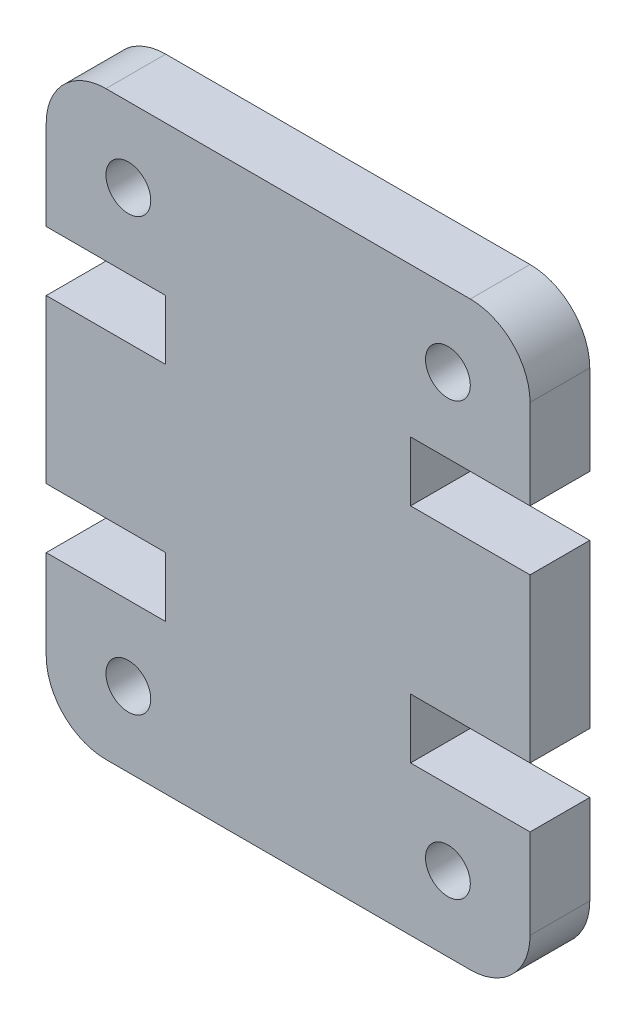
from build123d import *

# Parameters (mm, degrees)
SKETCH2_R           = 0.75
BOSS_EXTRUDE1_DEPTH = 4
SKETCH3_W           = 16.2
SKETCH3_H           = 19.455
CUT_EXTRUDE1_DEPTH  = 2


with BuildPart() as part:
    # Sketch2 → Boss-Extrude1 (new body)
    with BuildSketch(Plane.XY):
        with BuildLine():
            Line((0, 7), (0, 12.455))
            Line((0, 12.455), (4, 12.455))
            Line((4, 12.455), (4, 14.455))
            Line((4, 14.455), (0, 14.455))
            Line((0, 14.455), (0, 17.455))
            ThreePointArc((0, 17.455), (0.585786438, 18.869213562), (2, 19.455))
            Line((2, 19.455), (14.2, 19.455))
            ThreePointArc((14.2, 19.455), (15.614213562, 18.869213562), (16.2, 17.455))
            Line((16.2, 17.455), (16.2, 14.455))
            Line((16.2, 14.455), (12.2, 14.455))
            Line((12.2, 14.455), (12.2, 12.455))
            Line((12.2, 12.455), (16.2, 12.455))
            Line((16.2, 12.455), (16.2, 7))
            Line((16.2, 7), (12.2, 7))
            Line((12.2, 7), (12.2, 5))
            Line((12.2, 5), (16.2, 5))
            Line((16.2, 5), (16.2, 2))
            ThreePointArc((16.2, 2), (15.614213562, 0.585786438), (14.2, 0))
            Line((14.2, 0), (2, 0))
            ThreePointArc((2, 0), (0.585786438, 0.585786438), (0, 2))
            Line((0, 2), (0, 5))
            Line((0, 5), (4, 5))
            Line((4, 5), (4, 7))
            Line((4, 7), (0, 7))
        make_face()
        with Locations((13.45, 2.5)):
            Circle(SKETCH2_R, mode=Mode.SUBTRACT)
        with Locations((2.75, 16.955)):
            Circle(SKETCH2_R, mode=Mode.SUBTRACT)
        with Locations((2.75, 2.5)):
            Circle(SKETCH2_R, mode=Mode.SUBTRACT)
        with Locations((13.45, 16.955)):
            Circle(SKETCH2_R, mode=Mode.SUBTRACT)
    extrude(amount=BOSS_EXTRUDE1_DEPTH)

    # Sketch3 → Cut-Extrude1 (cut)
    with BuildSketch(Plane.XY.offset(4)):
        with Locations((8.1, 9.7275)):
            Rectangle(SKETCH3_W, SKETCH3_H)
    extrude(amount=-CUT_EXTRUDE1_DEPTH, mode=Mode.SUBTRACT)


solid = part.part
